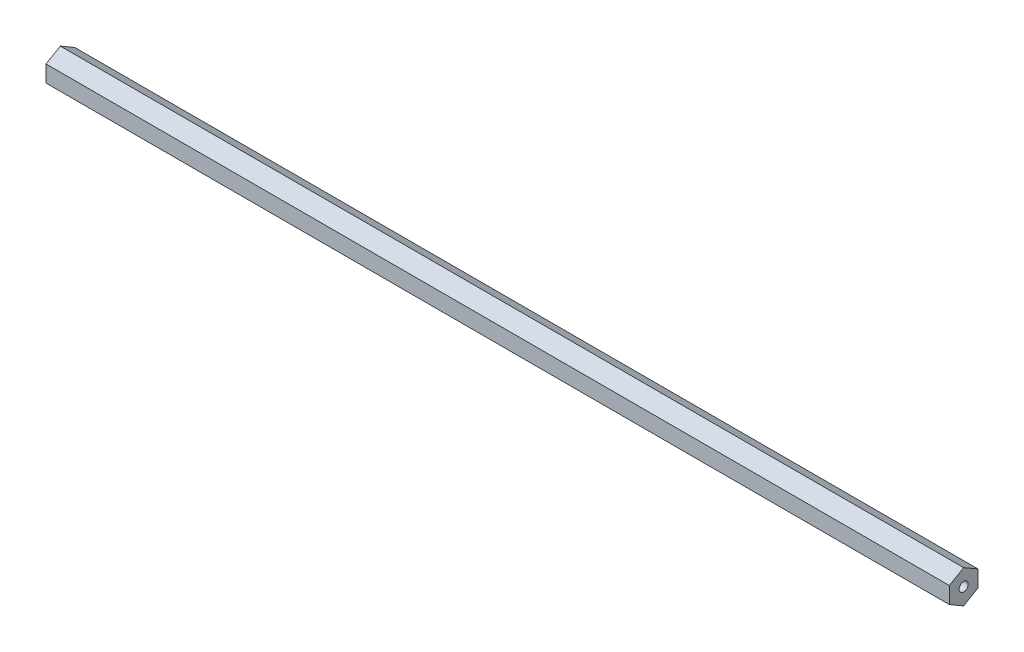
from build123d import *

# Parameters (mm, degrees)
BOSS_EXTRUDE1_DEPTH                  = 200.025
F_10_32_TAPPED_HOLE1_D               = 4.0386
F_10_32_TAPPED_HOLE1_DEPTH           = 16.34744
F_10_32_TAPPED_HOLE1_TIP             = 1.213317848
F_10_32_TAPPED_HOLE1_ON_FACE_2_D     = 4.0386
F_10_32_TAPPED_HOLE1_ON_FACE_2_DEPTH = 16.34744
F_10_32_TAPPED_HOLE1_ON_FACE_2_TIP   = 1.213317848


with BuildPart() as part:
    # Sketch1 → Boss-Extrude1 (new, symmetric)
    with BuildSketch(Plane(origin=(0, 0, 0), x_dir=(0, 0, -1), z_dir=(1, 0, 0))):
        Polygon((6.35, 3.666174209), (0, 7.332348419), (-6.35, 3.666174209), (-6.35, -3.666174209), (0, -7.332348419), (6.35, -3.666174209), align=None)
    extrude(amount=BOSS_EXTRUDE1_DEPTH, both=True)

    # #10-32 Tapped Hole1
    with Locations(Plane(origin=(200.025, 0, 0), x_dir=(0, 0, 1), z_dir=(1, 0, 0))):
        with Locations((0, 0)):
            Hole(F_10_32_TAPPED_HOLE1_D / 2, depth=F_10_32_TAPPED_HOLE1_DEPTH)
            with Locations((0, 0, -(F_10_32_TAPPED_HOLE1_DEPTH + F_10_32_TAPPED_HOLE1_TIP / 2))):  # 118° drill point
                Cone(0, F_10_32_TAPPED_HOLE1_D / 2, F_10_32_TAPPED_HOLE1_TIP, mode=Mode.SUBTRACT)

    # #10-32 Tapped Hole1 on face 2
    with Locations(Plane(origin=(-200.025, 0, 0), x_dir=(0, 0, -1), z_dir=(-1, 0, 0))):
        with Locations((0, 0)):
            Hole(F_10_32_TAPPED_HOLE1_ON_FACE_2_D / 2, depth=F_10_32_TAPPED_HOLE1_ON_FACE_2_DEPTH)
            with Locations((0, 0, -(F_10_32_TAPPED_HOLE1_ON_FACE_2_DEPTH + F_10_32_TAPPED_HOLE1_ON_FACE_2_TIP / 2))):  # 118° drill point
                Cone(0, F_10_32_TAPPED_HOLE1_ON_FACE_2_D / 2, F_10_32_TAPPED_HOLE1_ON_FACE_2_TIP, mode=Mode.SUBTRACT)


solid = part.part
